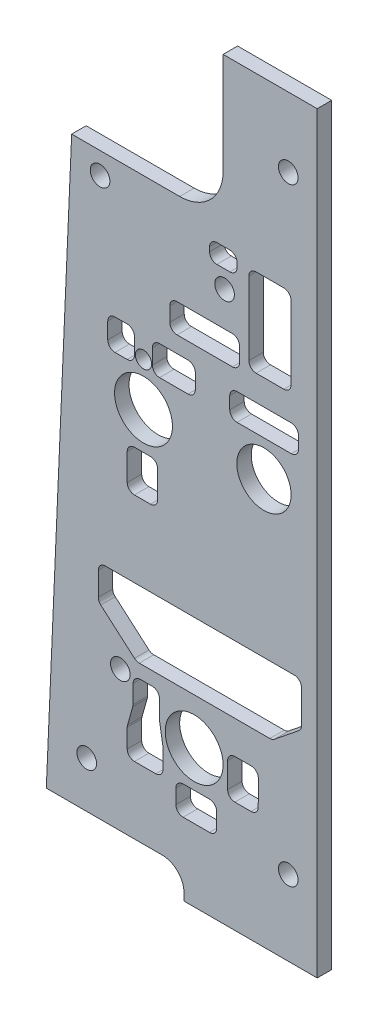
from build123d import *

# Parameters (mm, degrees)
BOSS_EXTRUDE1_DEPTH              = 3.175
F_6_CLEARANCE_HOLE1_D            = 4.3053
F_6_CLEARANCE_HOLE2_D            = 4.3053
F_9_64_0_14063_DIAMETER_HOLE1_D  = 3.572002
F_15_32_0_46875_DIAMETER_HOLE1_D = 11.90625
F_1_2_0_5_DIAMETER_HOLE1_D       = 12.7
CUT_EXTRUDE1_REACH               = 177.493
SKETCH12_W                       = 9.525
SKETCH12_H                       = 31.75
FILLET1_R                        = 9.525
CUT_EXTRUDE2_DEPTH               = 176.493172904


with BuildPart() as part:
    # Sketch1 → Boss-Extrude1 (new body)
    with BuildSketch(Plane.XY):
        with BuildLine():
            Line((-29.21, 1.5875), (-29.21, 0))
            Line((-29.21, 0), (0, 0))
            Line((0, 0), (0, 165.1))
            Line((0, 165.1), (-25.4, 165.1))
            Line((-25.4, 165.1), (-25.4, 138.1125))
            ThreePointArc((-25.4, 138.1125), (-26.794903955, 134.744903955), (-30.1625, 133.35))
            Line((-30.1625, 133.35), (-53.848, 133.35))
            Line((-53.848, 133.35), (-59.411809524, 6.35))
            Line((-59.411809524, 6.35), (-33.9725, 6.35))
            ThreePointArc((-33.9725, 6.35), (-30.604903955, 4.955096045), (-29.21, 1.5875))
        make_face()
    extrude(amount=-BOSS_EXTRUDE1_DEPTH)

    # #6 Clearance Hole1 (through all)
    with Locations(Plane.XY):
        with Locations((-47.625, 128.5875), (-6.35, 149.86), (-50.546, 16.51), (-6.35, 16.51)):
            Hole(F_6_CLEARANCE_HOLE1_D / 2)

    # #6 Clearance Hole2 (through all)
    with Locations(Plane.XY):
        with Locations((-43.18, 37.084), (-20.32, 120.65)):
            Hole(F_6_CLEARANCE_HOLE2_D / 2)

    # 9/64 (0.14063) Diameter Hole1 (through all)
    with Locations(Plane.XY):
        with Locations((-38.1, 98.425), (-36.5125, 30.1625)):
            Hole(F_9_64_0_14063_DIAMETER_HOLE1_D / 2)

    # 15/32 (0.46875) Diameter Hole1 (through all)
    with Locations(Plane.XY):
        with Locations((-11.684, 88.9)):
            Hole(F_15_32_0_46875_DIAMETER_HOLE1_D / 2)

    # 1/2 (0.5) Diameter Hole1 (through all)
    with Locations(Plane.XY):
        with Locations((-38.1, 88.9), (-26.9875, 30.1625)):
            Hole(F_1_2_0_5_DIAMETER_HOLE1_D / 2)

    # Sketch12 → Cut-Extrude1 (cut, up to next)
    with BuildSketch(Plane.XY, mode=Mode.PRIVATE) as cut_extrude1_sk1:
        with Locations((-25.4, 149.225)):
            Rectangle(SKETCH12_W, SKETCH12_H)
    cut_extrude1_tool1 = extrude(cut_extrude1_sk1.sketch, amount=-CUT_EXTRUDE1_REACH, mode=Mode.PRIVATE) & part.part
    add(cut_extrude1_tool1.solids().sort_by_distance((-25.4, 149.225, 0))[0], mode=Mode.SUBTRACT)

    # Fillet1
    fillet1_edges = [part.edges().sort_by_distance(p)[0] for p in [
        (-20.6375, 133.35, -1.5875),
    ]]
    fillet(fillet1_edges, radius=FILLET1_R)

    # Sketch13 → Cut-Extrude2 (cut, through all)
    with BuildSketch(Plane.XY):
        with BuildLine():
            Line((-30.747750154, 113.086358247), (-18.616014186, 113.086358247))
            ThreePointArc((-18.616014186, 113.086358247), (-17.493482171, 112.621390263), (-17.028514186, 111.498858247))
            Line((-17.028514186, 111.498858247), (-17.028514186, 108.358274098))
            ThreePointArc((-17.028514186, 108.358274098), (-17.493482171, 107.235742083), (-18.616014186, 106.770774098))
            Line((-18.616014186, 106.770774098), (-30.747750154, 106.770774098))
            ThreePointArc((-30.747750154, 106.770774098), (-31.870282169, 107.235742083), (-32.335250154, 108.358274098))
            Line((-32.335250154, 108.358274098), (-32.335250154, 111.498858247))
            ThreePointArc((-32.335250154, 111.498858247), (-31.870282169, 112.621390263), (-30.747750154, 113.086358247))
        make_face()
        with BuildLine():
            Line((-34.574215894, 103.194925639), (-28.325502594, 103.194925639))
            ThreePointArc((-28.325502594, 103.194925639), (-27.202970578, 102.729957655), (-26.738002594, 101.607425639))
            Line((-26.738002594, 101.607425639), (-26.738002594, 98.325945681))
            ThreePointArc((-26.738002594, 98.325945681), (-27.202970578, 97.203413666), (-28.325502594, 96.738445681))
            Line((-28.325502594, 96.738445681), (-34.574215894, 96.738445681))
            ThreePointArc((-34.574215894, 96.738445681), (-35.696747909, 97.203413666), (-36.161715894, 98.325945681))
            Line((-36.161715894, 98.325945681), (-36.161715894, 101.607425639))
            ThreePointArc((-36.161715894, 101.607425639), (-35.696747909, 102.729957655), (-34.574215894, 103.194925639))
        make_face()
        with BuildLine():
            Line((-40.080756518, 98.224999494), (-40.080756518, 101.78556236))
            ThreePointArc((-40.080756518, 101.78556236), (-40.545724503, 102.908094375), (-41.668256518, 103.37306236))
            Line((-41.668256518, 103.37306236), (-44.352806872, 103.37306236))
            ThreePointArc((-44.352806872, 103.37306236), (-45.475338887, 102.908094375), (-45.940306872, 101.78556236))
            Line((-45.940306872, 101.78556236), (-45.940306872, 98.224999494))
            ThreePointArc((-45.940306872, 98.224999494), (-45.475338887, 97.102467479), (-44.352806872, 96.637499494))
            Line((-44.352806872, 96.637499494), (-41.668256518, 96.637499494))
            ThreePointArc((-41.668256518, 96.637499494), (-40.545724503, 97.102467479), (-40.080756518, 98.224999494))
        make_face()
        with BuildLine():
            Line((-40.080756518, 80.759278088), (-36.575077921, 80.759278088))
            ThreePointArc((-36.575077921, 80.759278088), (-35.452545906, 80.294310103), (-34.987577921, 79.171778088))
            Line((-34.987577921, 79.171778088), (-34.987577921, 73.287722615))
            ThreePointArc((-34.987577921, 73.287722615), (-35.452545906, 72.165190599), (-36.575077921, 71.700222615))
            Line((-36.575077921, 71.700222615), (-40.080756518, 71.700222615))
            ThreePointArc((-40.080756518, 71.700222615), (-41.203288533, 72.165190599), (-41.668256518, 73.287722615))
            Line((-41.668256518, 73.287722615), (-41.668256518, 79.171778088))
            ThreePointArc((-41.668256518, 79.171778088), (-41.203288533, 80.294310103), (-40.080756518, 80.759278088))
        make_face()
        with BuildLine():
            Line((-17.594401847, 102.582143881), (-5.696041939, 102.582143881))
            ThreePointArc((-5.696041939, 102.582143881), (-4.573509924, 102.117175896), (-4.108541939, 100.994643881))
            Line((-4.108541939, 100.994643881), (-4.108541939, 98.325945681))
            ThreePointArc((-4.108541939, 98.325945681), (-4.573509924, 97.203413666), (-5.696041939, 96.738445681))
            Line((-5.696041939, 96.738445681), (-17.594401847, 96.738445681))
            ThreePointArc((-17.594401847, 96.738445681), (-18.716933862, 97.203413666), (-19.181901847, 98.325945681))
            Line((-19.181901847, 98.325945681), (-19.181901847, 100.994643881))
            ThreePointArc((-19.181901847, 100.994643881), (-18.716933862, 102.117175896), (-17.594401847, 102.582143881))
        make_face()
        with BuildLine():
            Line((-48.019090356, 53.428082865), (-48.019090356, 48.29494575))
            ThreePointArc((-48.019090356, 48.29494575), (-47.875751507, 47.635738028), (-47.471619717, 47.095572923))
            Line((-47.471619717, 47.095572923), (-40.072250924, 40.679252143))
            ThreePointArc((-40.072250924, 40.679252143), (-39.587267456, 40.391318578), (-39.032221563, 40.291124971))
            Line((-39.032221563, 40.291124971), (-10.394396549, 40.291124971))
            ThreePointArc((-10.394396549, 40.291124971), (-9.86658968, 40.381435551), (-9.398835151, 40.642092014))
            Line((-9.398835151, 40.642092014), (-4.044428972, 44.953048769))
            ThreePointArc((-4.044428972, 44.953048769), (-3.608101763, 45.50412475), (-3.45249037, 46.189581725))
            Line((-3.45249037, 46.189581725), (-3.45249037, 53.428082865))
            ThreePointArc((-3.45249037, 53.428082865), (-3.917458355, 54.55061488), (-5.03999037, 55.015582865))
            Line((-5.03999037, 55.015582865), (-46.431590356, 55.015582865))
            ThreePointArc((-46.431590356, 55.015582865), (-47.554122371, 54.55061488), (-48.019090356, 53.428082865))
        make_face()
        with BuildLine():
            Line((-40.384497263, 35.736689818), (-40.384497263, 31.765164549))
            ThreePointArc((-40.384497263, 31.765164549), (-40.399363489, 31.548417545), (-40.443683737, 31.335730019))
            Line((-40.443683737, 31.335730019), (-41.604871442, 27.203181856))
            ThreePointArc((-41.604871442, 27.203181856), (-41.64919169, 26.99049433), (-41.664057916, 26.773747326))
            Line((-41.664057916, 26.773747326), (-41.664057916, 22.672560488))
            ThreePointArc((-41.664057916, 22.672560488), (-41.199089931, 21.550028473), (-40.076557916, 21.085060488))
            Line((-40.076557916, 21.085060488), (-35.415894114, 21.085060488))
            ThreePointArc((-35.415894114, 21.085060488), (-34.293362099, 21.550028473), (-33.828394114, 22.672560488))
            Line((-33.828394114, 22.672560488), (-33.828394114, 26.863403798))
            ThreePointArc((-33.828394114, 26.863403798), (-33.833620786, 26.992118078), (-33.849266386, 27.119984802))
            Line((-33.849266386, 27.119984802), (-34.553343622, 31.418927073))
            ThreePointArc((-34.553343622, 31.418927073), (-34.568989222, 31.546793797), (-34.574215894, 31.675508077))
            Line((-34.574215894, 31.675508077), (-34.574215894, 35.736689818))
            ThreePointArc((-34.574215894, 35.736689818), (-35.039183879, 36.859221833), (-36.161715894, 37.324189818))
            Line((-36.161715894, 37.324189818), (-38.796997263, 37.324189818))
            ThreePointArc((-38.796997263, 37.324189818), (-39.919529278, 36.859221833), (-40.384497263, 35.736689818))
        make_face()
        with BuildLine():
            Line((-29.406515481, 22.159407852), (-23.623512078, 22.159407852))
            ThreePointArc((-23.623512078, 22.159407852), (-22.500980063, 21.694439868), (-22.036012078, 20.571907852))
            Line((-22.036012078, 20.571907852), (-22.036012078, 17.427443633))
            ThreePointArc((-22.036012078, 17.427443633), (-22.500980063, 16.304911618), (-23.623512078, 15.839943633))
            Line((-23.623512078, 15.839943633), (-29.406515481, 15.839943633))
            ThreePointArc((-29.406515481, 15.839943633), (-30.529047497, 16.304911618), (-30.994015481, 17.427443633))
            Line((-30.994015481, 17.427443633), (-30.994015481, 20.571907852))
            ThreePointArc((-30.994015481, 20.571907852), (-30.529047497, 21.694439868), (-29.406515481, 22.159407852))
        make_face()
        with BuildLine():
            Line((-19.652205933, 31.45310542), (-19.652205933, 25.961326294))
            ThreePointArc((-19.652205933, 25.961326294), (-19.187237948, 24.838794279), (-18.064705933, 24.373826294))
            Line((-18.064705933, 24.373826294), (-14.523884595, 24.373826294))
            ThreePointArc((-14.523884595, 24.373826294), (-13.404315452, 24.835839206), (-12.936406656, 25.952957085))
            Line((-12.936406656, 25.952957085), (-12.907453911, 31.444736212))
            ThreePointArc((-12.907453911, 31.444736212), (-13.369444762, 32.572674563), (-14.49493185, 33.04060542))
            Line((-14.49493185, 33.04060542), (-18.064705933, 33.04060542))
            ThreePointArc((-18.064705933, 33.04060542), (-19.187237948, 32.575637435), (-19.652205933, 31.45310542))
        make_face()
        with BuildLine():
            Line((-22.01713897, 128.678018273), (-19.152782073, 128.678018273))
            ThreePointArc((-19.152782073, 128.678018273), (-18.030250058, 128.213050288), (-17.565282073, 127.090518273))
            Line((-17.565282073, 127.090518273), (-17.565282073, 126.119376704))
            ThreePointArc((-17.565282073, 126.119376704), (-18.030250058, 124.996844689), (-19.152782073, 124.531876704))
            Line((-19.152782073, 124.531876704), (-22.01713897, 124.531876704))
            ThreePointArc((-22.01713897, 124.531876704), (-23.139670985, 124.996844689), (-23.60463897, 126.119376704))
            Line((-23.60463897, 126.119376704), (-23.60463897, 127.090518273))
            ThreePointArc((-23.60463897, 127.090518273), (-23.139670985, 128.213050288), (-22.01713897, 128.678018273))
        make_face()
        with BuildLine():
            Line((-13.406523982, 127.403418477), (-7.328378053, 127.403418477))
            ThreePointArc((-7.328378053, 127.403418477), (-6.205846037, 126.938450492), (-5.740878053, 125.815918477))
            Line((-5.740878053, 125.815918477), (-5.740878053, 109.754303777))
            ThreePointArc((-5.740878053, 109.754303777), (-6.205846037, 108.631771762), (-7.328378053, 108.166803777))
            Line((-7.328378053, 108.166803777), (-13.406523982, 108.166803777))
            ThreePointArc((-13.406523982, 108.166803777), (-14.529055997, 108.631771762), (-14.994023982, 109.754303777))
            Line((-14.994023982, 109.754303777), (-14.994023982, 125.815918477))
            ThreePointArc((-14.994023982, 125.815918477), (-14.529055997, 126.938450492), (-13.406523982, 127.403418477))
        make_face()
    extrude(amount=-CUT_EXTRUDE2_DEPTH, mode=Mode.SUBTRACT)


solid = part.part
